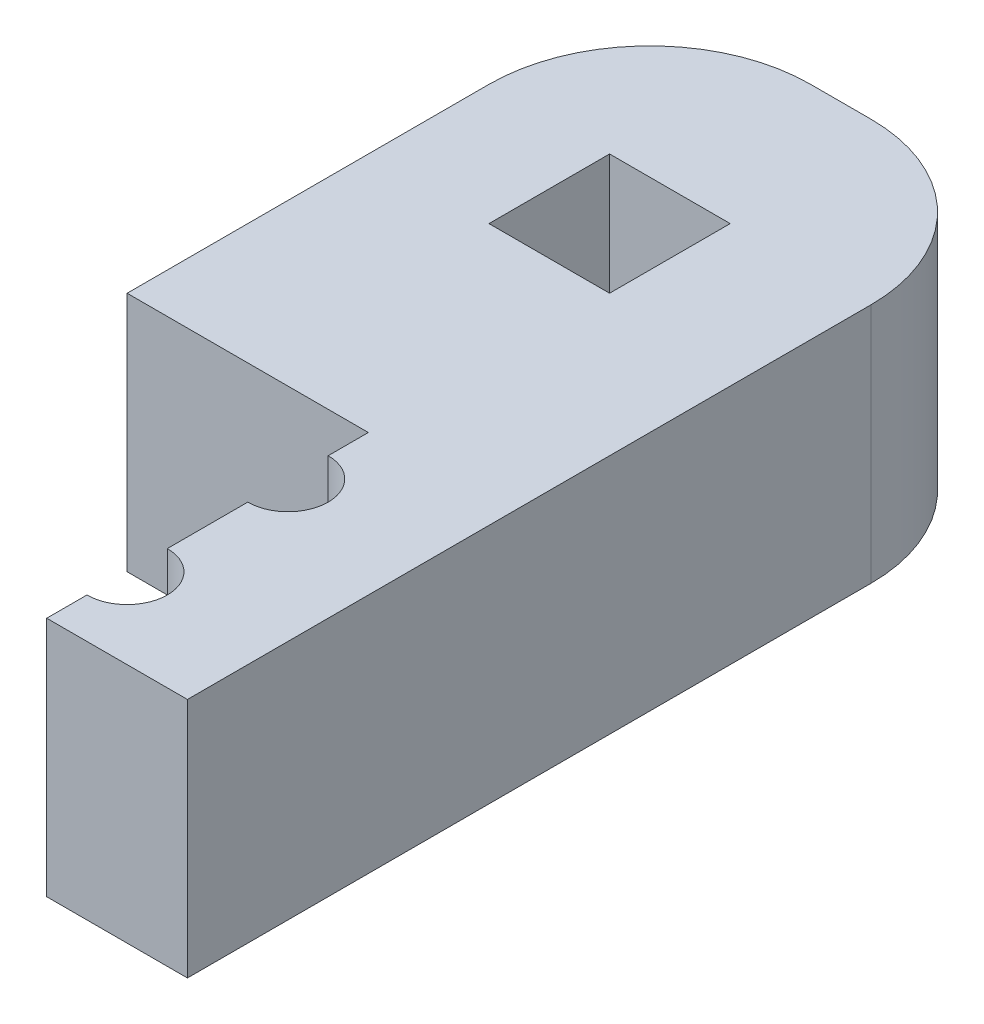
from build123d import *

# Parameters (mm, degrees)
BOSS_EXTRUDE1_DEPTH = 6
SKETCH2_R           = 1
SKETCH2_W           = 3
SKETCH2_H           = 3
CUT_EXTRUDE1_DEPTH  = 18.182840277
FILLET1_R           = 4


with BuildPart() as part:
    # Sketch1 → Boss-Extrude1 (new body)
    with BuildSketch(Plane(origin=(0, 0, 0), x_dir=(1, 0, 0), z_dir=(0, 1, 0))):
        Polygon((0, 13), (9.5, 13), (9.5, -8), (6, -8), (6, 0), (0, 0), align=None)
    extrude(amount=BOSS_EXTRUDE1_DEPTH)

    # Sketch2 → Cut-Extrude1 (cut, through all)
    with BuildSketch(Plane(origin=(0, 6, 0), x_dir=(1, 0, 0), z_dir=(0, 1, 0))):
        with Locations((6, -2)):
            Circle(SKETCH2_R)
        with Locations((6, -6)):
            Circle(SKETCH2_R)
        with Locations((4.5, 7.5)):
            Rectangle(SKETCH2_W, SKETCH2_H)
    extrude(amount=-CUT_EXTRUDE1_DEPTH, mode=Mode.SUBTRACT)

    # Fillet1
    fillet1_edges = [part.edges().sort_by_distance(p)[0] for p in [
        (9.5, 3, -13),
        (0, 3, -13),
    ]]
    fillet(fillet1_edges, radius=FILLET1_R)


solid = part.part
